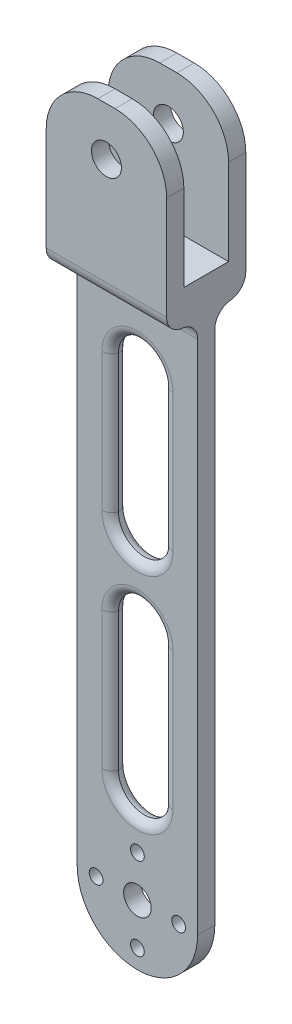
from build123d import *

# Parameters (mm, degrees)
SKETCH1_R                = 2
BOSS_EXTRUDE2_DEPTH      = 5
BOSS_EXTRUDE3_DEPTH      = 9
BOSS_EXTRUDE3_DEPTH_BACK = 14
SKETCH3_W                = 35
SKETCH3_H                = 50
SKETCH4_W                = 13
SKETCH4_H                = 40
CUT_EXTRUDE1_DEPTH       = 194.703381488
SKETCH5_R                = 4.35
CUT_EXTRUDE2_DEPTH       = 194.053917795
CUT_EXTRUDE3_DEPTH       = 193.189529309
FILLET14_R               = 15
FILLET15_R               = 15
FILLET16_R               = 15
FILLET17_R               = 15
FILLET18_R               = 5
FILLET19_R               = 5
FILLET20_R               = 5
FILLET21_R               = 5
FILLET22_R               = 3
FILLET23_R               = 3
FILLET24_R               = 3
FILLET25_R               = 3
SKETCH7_R                = 4
CUT_EXTRUDE4_DEPTH       = 193.189529428


with BuildPart() as part:
    # Sketch1 → Boss-Extrude2 (new body)
    with BuildSketch(Plane.XY):
        with BuildLine():
            Line((-9.685672515, -15), (-9.685672515, 190))
            Line((-9.685672515, 190), (25.314327485, 190))
            Line((25.314327485, 190), (25.314327485, -15))
            ThreePointArc((25.314327485, -15), (7.814327485, -32.5), (-9.685672515, -15))
        make_face()
        with Locations((19.814327485, -15)):
            Circle(SKETCH1_R, mode=Mode.SUBTRACT)
        with Locations((7.814327485, -27)):
            Circle(SKETCH1_R, mode=Mode.SUBTRACT)
        with Locations((-4.185672515, -15)):
            Circle(SKETCH1_R, mode=Mode.SUBTRACT)
        with Locations((7.814327485, -3)):
            Circle(SKETCH1_R, mode=Mode.SUBTRACT)
    extrude(amount=BOSS_EXTRUDE2_DEPTH)

    # Sketch3 → Boss-Extrude3 (add, two sides: drawn at the far end of the back side and taken through both)
    with BuildSketch(Plane.XY.offset(5).offset(-BOSS_EXTRUDE3_DEPTH_BACK)):
        with Locations((7.814327485, 165)):
            Rectangle(SKETCH3_W, SKETCH3_H)
    extrude(amount=BOSS_EXTRUDE3_DEPTH + BOSS_EXTRUDE3_DEPTH_BACK)

    # Sketch4 → Cut-Extrude1 (cut, through all)
    with BuildSketch(Plane(origin=(25.314327485, 0, 0), x_dir=(0, 0, -1), z_dir=(1, 0, 0))):
        with Locations((-2.5, 170)):
            Rectangle(SKETCH4_W, SKETCH4_H)
    extrude(amount=-CUT_EXTRUDE1_DEPTH, mode=Mode.SUBTRACT)

    # Sketch5 → Cut-Extrude2 (cut, through all)
    with BuildSketch(Plane.XY.offset(14)):
        with Locations((7.814327485, 176)):
            Circle(SKETCH5_R)
    extrude(amount=-CUT_EXTRUDE2_DEPTH, mode=Mode.SUBTRACT)

    # Sketch6 → Cut-Extrude3 (cut, through all)
    with BuildSketch(Plane.XY.offset(5)):
        with BuildLine():
            Line((15.314327485, 118), (15.314327485, 78))
            ThreePointArc((15.314327485, 78), (7.814327485, 70.5), (0.314327485, 78))
            Line((0.314327485, 78), (0.314327485, 118))
            ThreePointArc((0.314327485, 118), (7.814327485, 125.5), (15.314327485, 118))
        make_face()
        with BuildLine():
            Line((15.314327485, 53), (15.314327485, 13))
            ThreePointArc((15.314327485, 13), (7.814327485, 5.5), (0.314327485, 13))
            Line((0.314327485, 13), (0.314327485, 53))
            ThreePointArc((0.314327485, 53), (7.814327485, 60.5), (15.314327485, 53))
        make_face()
    extrude(amount=-CUT_EXTRUDE3_DEPTH, mode=Mode.SUBTRACT)

    # Fillet14
    fillet14_edges = [part.edges().sort_by_distance(p)[0] for p in [
        (25.314327485, 190, 11.5),
    ]]
    fillet(fillet14_edges, radius=FILLET14_R)

    # Fillet15
    fillet15_edges = [part.edges().sort_by_distance(p)[0] for p in [
        (-9.685672515, 190, 11.5),
    ]]
    fillet(fillet15_edges, radius=FILLET15_R)

    # Fillet16
    fillet16_edges = [part.edges().sort_by_distance(p)[0] for p in [
        (-9.685672515, 190, -6.5),
    ]]
    fillet(fillet16_edges, radius=FILLET16_R)

    # Fillet17
    fillet17_edges = [part.edges().sort_by_distance(p)[0] for p in [
        (25.314327485, 190, -6.5),
    ]]
    fillet(fillet17_edges, radius=FILLET17_R)

    # Fillet18
    fillet18_edges = [part.edges().sort_by_distance(p)[0] for p in [
        (7.814327485, 140, 5),
    ]]
    fillet(fillet18_edges, radius=FILLET18_R)

    # Fillet19
    fillet19_edges = [part.edges().sort_by_distance(p)[0] for p in [
        (7.814327485, 140, 0),
    ]]
    fillet(fillet19_edges, radius=FILLET19_R)

    # Fillet20
    fillet20_edges = [part.edges().sort_by_distance(p)[0] for p in [
        (7.814327485, 140, -9),
    ]]
    fillet(fillet20_edges, radius=FILLET20_R)

    # Fillet21
    fillet21_edges = [part.edges().sort_by_distance(p)[0] for p in [
        (7.814327485, 140, 14),
    ]]
    fillet(fillet21_edges, radius=FILLET21_R)

    # Fillet22
    fillet22_edges = [part.edges().sort_by_distance(p)[0] for p in [
        (0.314327485, 98, 0),
        (7.814327485, 70.5, 0),
        (15.314327485, 98, 0),
        (7.814327485, 125.5, 0),
    ]]
    fillet(fillet22_edges, radius=FILLET22_R)

    # Fillet23
    # the kernel refuses this fillet: 3 mm, written as the material it takes off along each edge
    with BuildSketch(Plane(origin=(15.314327485, 118, 5), x_dir=(0, 0, -1), z_dir=(0, -1, 0)), Plane(origin=(0.314327485, 78, 5), x_dir=(0, 0, -1), z_dir=(0, 1, 0))) as fillet23_piece_1:
        with BuildLine():
            CenterArc((3, 2.828427125), FILLET23_R, 180, 70.528779366)
            Line((0, 2.828427125), (-0.06, 2.828427125))
            Line((-0.06, 2.828427125), (-0.06, 0))
            Line((-0.06, 0), (0, -0.06))
            ThreePointArc((0, -0.06), (1, -0.06), (1.98, -0.056568542))
            Line((1.98, -0.056568542), (2, 0))
        make_face()
    extrude(amount=40, mode=Mode.SUBTRACT)
    with BuildSketch(Plane(origin=(7.814327485, 78, 5), x_dir=(1, 0, 0), z_dir=(0, 1, 0))) as fillet23_piece_2:
        with BuildLine():
            CenterArc((10.328427125, 3), FILLET23_R, 199.471220634, 70.528779366)
            Line((10.328427125, 0), (10.328427125, -0.06))
            Line((10.328427125, -0.06), (7.5, -0.06))
            Line((7.5, -0.06), (7.44, 0))
            ThreePointArc((7.44, 0), (7.44, 1), (7.443431458, 1.98))
            Line((7.443431458, 1.98), (7.5, 2))
        make_face()
    revolve(axis=Axis((7.814327485, 78, 5), (0, 0, -1)), revolution_arc=180, mode=Mode.SUBTRACT)
    with BuildSketch(Plane(origin=(7.814327485, 118, 5), x_dir=(-1, 0, 0), z_dir=(0, -1, 0))) as fillet23_piece_3:
        with BuildLine():
            CenterArc((10.328427125, 3), FILLET23_R, 199.471220634, 70.528779366)
            Line((10.328427125, 0), (10.328427125, -0.06))
            Line((10.328427125, -0.06), (7.5, -0.06))
            Line((7.5, -0.06), (7.44, 0))
            ThreePointArc((7.44, 0), (7.44, 1), (7.443431458, 1.98))
            Line((7.443431458, 1.98), (7.5, 2))
        make_face()
    revolve(axis=Axis((7.814327485, 118, 5), (0, 0, -1)), revolution_arc=180, mode=Mode.SUBTRACT)

    # Fillet24
    fillet24_edges = [part.edges().sort_by_distance(p)[0] for p in [
        (0.314327485, 33, 0),
        (7.814327485, 5.5, 0),
        (15.314327485, 33, 0),
        (7.814327485, 60.5, 0),
    ]]
    fillet(fillet24_edges, radius=FILLET24_R)

    # Fillet25
    # the kernel refuses this fillet: 3 mm, written as the material it takes off along each edge
    with BuildSketch(Plane(origin=(15.314327485, 53, 5), x_dir=(0, 0, -1), z_dir=(0, -1, 0)), Plane(origin=(0.314327485, 13, 5), x_dir=(0, 0, -1), z_dir=(0, 1, 0))) as fillet25_piece_1:
        with BuildLine():
            CenterArc((3, 2.828427125), FILLET25_R, 180, 70.528779366)
            Line((0, 2.828427125), (-0.06, 2.828427125))
            Line((-0.06, 2.828427125), (-0.06, 0))
            Line((-0.06, 0), (0, -0.06))
            ThreePointArc((0, -0.06), (1, -0.06), (1.98, -0.056568542))
            Line((1.98, -0.056568542), (2, 0))
        make_face()
    extrude(amount=40, mode=Mode.SUBTRACT)
    with BuildSketch(Plane(origin=(7.814327485, 13, 5), x_dir=(1, 0, 0), z_dir=(0, 1, 0))) as fillet25_piece_2:
        with BuildLine():
            CenterArc((10.328427125, 3), FILLET25_R, 199.471220634, 70.528779366)
            Line((10.328427125, 0), (10.328427125, -0.06))
            Line((10.328427125, -0.06), (7.5, -0.06))
            Line((7.5, -0.06), (7.44, 0))
            ThreePointArc((7.44, 0), (7.44, 1), (7.443431458, 1.98))
            Line((7.443431458, 1.98), (7.5, 2))
        make_face()
    revolve(axis=Axis((7.814327485, 13, 5), (0, 0, -1)), revolution_arc=180, mode=Mode.SUBTRACT)
    with BuildSketch(Plane(origin=(7.814327485, 53, 5), x_dir=(-1, 0, 0), z_dir=(0, -1, 0))) as fillet25_piece_3:
        with BuildLine():
            CenterArc((10.328427125, 3), FILLET25_R, 199.471220634, 70.528779366)
            Line((10.328427125, 0), (10.328427125, -0.06))
            Line((10.328427125, -0.06), (7.5, -0.06))
            Line((7.5, -0.06), (7.44, 0))
            ThreePointArc((7.44, 0), (7.44, 1), (7.443431458, 1.98))
            Line((7.443431458, 1.98), (7.5, 2))
        make_face()
    revolve(axis=Axis((7.814327485, 53, 5), (0, 0, -1)), revolution_arc=180, mode=Mode.SUBTRACT)

    # Sketch7 → Cut-Extrude4 (cut, through all)
    with BuildSketch(Plane.XY.offset(5)):
        with Locations((7.814327485, -15)):
            Circle(SKETCH7_R)
    extrude(amount=-CUT_EXTRUDE4_DEPTH, mode=Mode.SUBTRACT)


solid = part.part
